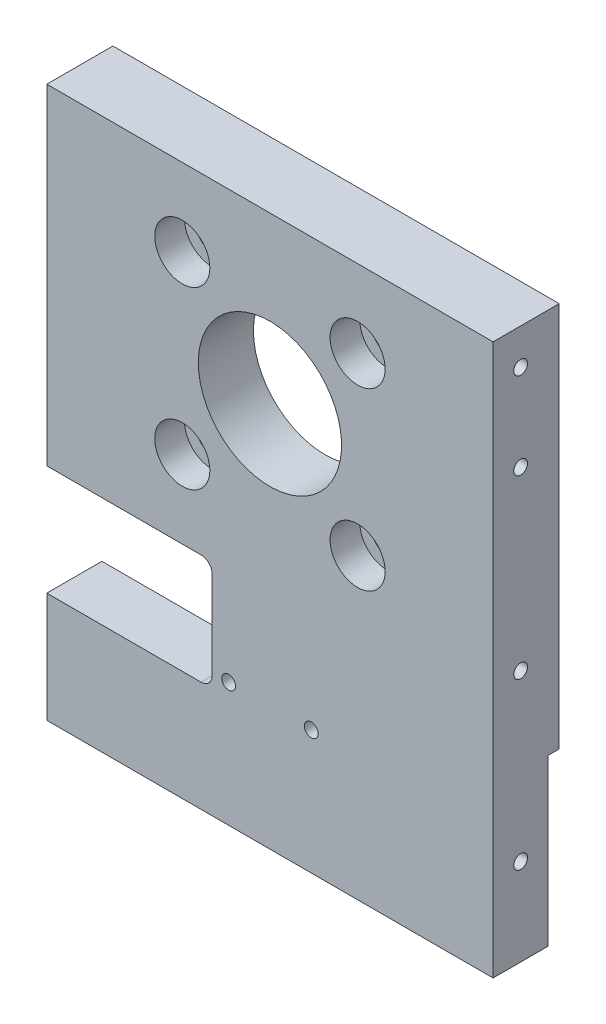
from build123d import *

# Parameters (mm, degrees)
SKETCH_1_W                   = 81
SKETCH_1_H                   = 100
EXTRUDE_1_DEPTH              = 12
SKETCH_2_R                   = 13
CUT_EXTRUDE_1_DEPTH          = 66.454182448
HOLE_WIZARD_M5_1_D           = 5.5
HOLE_WIZARD_M5_1_CBORE_D     = 10
HOLE_WIZARD_M5_1_CBORE_DEPTH = 5.4
HOLE_WIZARD_M3_1_AT_2_COUNT  = 2
HOLE_WIZARD_M3_1_AT_2_PITCH  = 15.7
HOLE_WIZARD_M3_1_AT_3_COUNT  = 2
HOLE_WIZARD_M3_1_AT_3_PITCH  = 47.7
HOLE_WIZARD_M3_1_AT_4_COUNT  = 2
HOLE_WIZARD_M3_1_AT_4_PITCH  = 77.7
SKETCH_9_R                   = 16.5
CUT_EXTRUDE_2_DEPTH          = 2
SKETCH_10_W                  = 81
SKETCH_10_H                  = 30
CUT_EXTRUDE_3_DEPTH          = 2
SKETCH_11_W                  = 60
SKETCH_11_H                  = 20
CUT_EXTRUDE_4_DEPTH          = 84
FILLET_1_R                   = 2
HOLE_WIZARD_M3_2_D           = 2.5
HOLE_WIZARD_M3_2_DEPTH       = 7.5
HOLE_WIZARD_M3_2_TIP         = 0.751075774


with BuildPart() as part:
    # 草图1 → 凸台-拉伸1 (new body)
    with BuildSketch(Plane.XY):
        Rectangle(SKETCH_1_W, SKETCH_1_H)
    extrude(amount=EXTRUDE_1_DEPTH)

    # 草图2 → 切除-拉伸1 (cut, through all)
    with BuildSketch(Plane(origin=(0, 0, 0), x_dir=(-1, 0, 0), z_dir=(0, 0, -1))):
        with Locations((0, 20)):
            Circle(SKETCH_2_R)
    extrude(amount=-CUT_EXTRUDE_1_DEPTH, mode=Mode.SUBTRACT)

    # M5 六角凹头螺钉的柱形沉头孔1 (through all)
    with Locations(Plane.XY.offset(12)):
        with Locations((-15.909902577, 35.909902577), (15.909902577, 35.909902577), (15.909902577, 4.090097423), (-15.909902577, 4.090097423), (0, 20)):
            CounterBoreHole(HOLE_WIZARD_M5_1_D / 2, HOLE_WIZARD_M5_1_CBORE_D / 2, HOLE_WIZARD_M5_1_CBORE_DEPTH)

    # 草图7 → M3 螺纹孔1 (revolve, cut)
    with BuildSketch(Plane(origin=(-40.5, 43.5, 7), x_dir=(0, 0, 1), z_dir=(0, 1, 0))):
        Polygon((0, 0), (0, 8.251075774), (1.25, 7.5), (1.25, 0), align=None)
    hole_wizard_m3_1 = revolve(axis=Axis((-46.85, 43.5, 7), (1, 0, 0)), mode=Mode.SUBTRACT)

    # M3 螺纹孔1 at 2: M3 螺纹孔1 ×2
    with Locations(*[(0, -i * HOLE_WIZARD_M3_1_AT_2_PITCH, 0) for i in range(1, HOLE_WIZARD_M3_1_AT_2_COUNT)]):
        add(hole_wizard_m3_1, mode=Mode.SUBTRACT)

    # M3 螺纹孔1 at 3: M3 螺纹孔1 ×2
    with Locations(*[(0, -i * HOLE_WIZARD_M3_1_AT_3_PITCH, 0) for i in range(1, HOLE_WIZARD_M3_1_AT_3_COUNT)]):
        add(hole_wizard_m3_1, mode=Mode.SUBTRACT)

    # M3 螺纹孔1 at 4: M3 螺纹孔1 ×2
    with Locations(*[(0, -i * HOLE_WIZARD_M3_1_AT_4_PITCH, 0) for i in range(1, HOLE_WIZARD_M3_1_AT_4_COUNT)]):
        add(hole_wizard_m3_1, mode=Mode.SUBTRACT)

    # 镜向1: M3 螺纹孔1 across plane
    add(hole_wizard_m3_1.mirror(Plane(origin=(0, 0, 0), x_dir=(0, 0, 1), z_dir=(1, 0, 0))), mode=Mode.SUBTRACT)

    # 镜向1 copy 1 sketch → 镜向1 copy 1 (revolve, cut)
    with BuildSketch(Plane(origin=(40.5, 27.8, 7), x_dir=(0, 0, 1), z_dir=(0, 1, 0))):
        Polygon((0, 0), (0, -8.251075774), (1.25, -7.5), (1.25, 0), align=None)
    revolve(axis=Axis((46.85, 27.8, 7), (1, 0, 0)), mode=Mode.SUBTRACT)

    # 镜向1 copy 2 sketch → 镜向1 copy 2 (revolve, cut)
    with BuildSketch(Plane(origin=(40.5, -4.2, 7), x_dir=(0, 0, 1), z_dir=(0, 1, 0))):
        Polygon((0, 0), (0, -8.251075774), (1.25, -7.5), (1.25, 0), align=None)
    revolve(axis=Axis((46.85, -4.2, 7), (1, 0, 0)), mode=Mode.SUBTRACT)

    # 镜向1 copy 3 sketch → 镜向1 copy 3 (revolve, cut)
    with BuildSketch(Plane(origin=(40.5, -34.2, 7), x_dir=(0, 0, 1), z_dir=(0, 1, 0))):
        Polygon((0, 0), (0, -8.251075774), (1.25, -7.5), (1.25, 0), align=None)
    revolve(axis=Axis((46.85, -34.2, 7), (1, 0, 0)), mode=Mode.SUBTRACT)

    # 草图9 → 切除-拉伸2 (cut)
    with BuildSketch(Plane(origin=(0, 0, 0), x_dir=(-1, 0, 0), z_dir=(0, 0, -1))):
        with Locations((0, 20)):
            Circle(SKETCH_9_R)
    extrude(amount=-CUT_EXTRUDE_2_DEPTH, mode=Mode.SUBTRACT)

    # 草图10 → 切除-拉伸3 (cut)
    with BuildSketch(Plane(origin=(0, 0, 0), x_dir=(-1, 0, 0), z_dir=(0, 0, -1))):
        with Locations((0, -35)):
            Rectangle(SKETCH_10_W, SKETCH_10_H)
    extrude(amount=-CUT_EXTRUDE_3_DEPTH, mode=Mode.SUBTRACT)

    # 草图11 → 切除-拉伸4 (cut)
    with BuildSketch(Plane(origin=(0, 0, 0), x_dir=(-1, 0, 0), z_dir=(0, 0, -1))):
        with Locations((40.5, -20)):
            Rectangle(SKETCH_11_W, SKETCH_11_H)
    extrude(amount=-CUT_EXTRUDE_4_DEPTH, mode=Mode.SUBTRACT)

    # 圆角1
    fillet_1_edges = [part.edges().sort_by_distance(p)[0] for p in [
        (-10.5, -30, 7),
        (-10.5, -10, 6),
    ]]
    fillet(fillet_1_edges, radius=FILLET_1_R)

    # M3 螺纹孔2
    with Locations(Plane.XY.offset(12)):
        with Locations((7.5, -27.5), (-7.5, -27.5)):
            Hole(HOLE_WIZARD_M3_2_D / 2, depth=HOLE_WIZARD_M3_2_DEPTH)
            with Locations((0, 0, -(HOLE_WIZARD_M3_2_DEPTH + HOLE_WIZARD_M3_2_TIP / 2))):  # 118° drill point
                Cone(0, HOLE_WIZARD_M3_2_D / 2, HOLE_WIZARD_M3_2_TIP, mode=Mode.SUBTRACT)


solid = part.part
